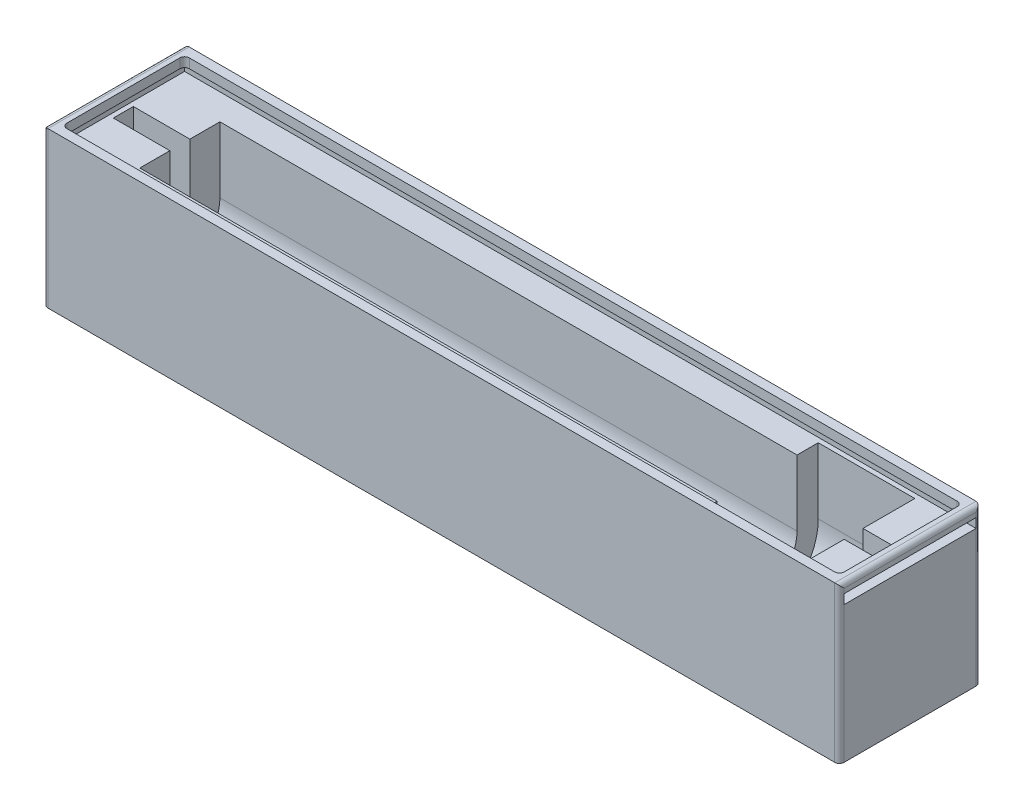
from build123d import *

# Parameters (mm, degrees)
BOSS_EXTRUDE1_DEPTH = 165
SKETCH3_W           = 30
SKETCH3_H           = 32
BOSS_EXTRUDE2_DEPTH = 2
SKETCH4_W           = 30
SKETCH4_H           = 32
BOSS_EXTRUDE3_DEPTH = 2
BOSS_EXTRUDE4_START = 10
BOSS_EXTRUDE4_DEPTH = 10
CUT_EXTRUDE1_DEPTH  = 10
BOSS_EXTRUDE6_DEPTH = 15
CUT_EXTRUDE2_DEPTH  = 15
BOSS_EXTRUDE7_DEPTH = 121
CUT_EXTRUDE3_DEPTH  = 121
SKETCH13_W          = 169
SKETCH13_H          = 30
CUT_EXTRUDE5_DEPTH  = 3
SKETCH14_W          = 169
SKETCH14_H          = 30
BOSS_EXTRUDE8_DEPTH = 3
SKETCH12_W          = 28
SKETCH12_H          = 2
CUT_EXTRUDE6_DEPTH  = 168
SKETCH16_W          = 165
SKETCH16_H          = 26
CUT_EXTRUDE7_DEPTH  = 3
CUT_EXTRUDE8_DEPTH  = 1.5
CUT_EXTRUDE9_DEPTH  = 3
SKETCH20_W          = 169
SKETCH20_H          = 30
BOSS_EXTRUDE9_DEPTH = 1
SKETCH21_W          = 165
SKETCH21_H          = 26
CUT_EXTRUDE10_DEPTH = 1
FILLET1_START       = -16
FILLET1_DEPTH       = 35
FILLET1_2_DEPTH     = 32
FILLET2_R           = 1


with BuildPart() as part:
    # Sketch2 → Boss-Extrude1 (new body)
    with BuildSketch(Plane(origin=(0, 0, 0), x_dir=(0, 0, -1), z_dir=(1, 0, 0))):
        with BuildLine():
            Line((-13, 0), (-13, 17))
            Line((-13, 17), (-15, 17))
            Line((-15, 17), (-15, -15))
            Line((-15, -15), (15, -15))
            Line((15, -15), (15, 17))
            Line((15, 17), (13, 17))
            Line((13, 17), (13, 0))
            ThreePointArc((13, 0), (0, -13), (-13, 0))
        make_face()
    extrude(amount=BOSS_EXTRUDE1_DEPTH)

    # Sketch3 → Boss-Extrude2 (add)
    with BuildSketch(Plane(origin=(165, 0, 0), x_dir=(0, 0, -1), z_dir=(1, 0, 0))):
        with Locations((0, 1)):
            Rectangle(SKETCH3_W, SKETCH3_H)
    extrude(amount=BOSS_EXTRUDE2_DEPTH)

    # Sketch4 → Boss-Extrude3 (add)
    with BuildSketch(Plane.ZY):
        with Locations((0, 1)):
            Rectangle(SKETCH4_W, SKETCH4_H)
    extrude(amount=BOSS_EXTRUDE3_DEPTH)

    # Sketch5 → Boss-Extrude4 (add)
    with BuildSketch(Plane.ZY.offset(-165).offset(BOSS_EXTRUDE4_START)):
        with BuildLine():
            Line((-13, 17), (-13, 0))
            ThreePointArc((-13, 0), (0, -13), (13, 0))
            Line((13, 0), (13, 17))
            Line((13, 17), (-13, 17))
        make_face()
    extrude(amount=-BOSS_EXTRUDE4_DEPTH)

    # Sketch6 → Cut-Extrude1 (cut)
    with BuildSketch(Plane.ZY.offset(-155)):
        with BuildLine():
            Line((-2, 0), (-2, 17))
            Line((-2, 17), (2, 17))
            Line((2, 17), (2, 0))
            ThreePointArc((2, 0), (0, -2), (-2, 0))
        make_face()
    extrude(amount=-CUT_EXTRUDE1_DEPTH, mode=Mode.SUBTRACT)

    # Sketch8 → Boss-Extrude6 (add)
    with BuildSketch(Plane(origin=(0, 0, 0), x_dir=(0, 0, -1), z_dir=(1, 0, 0))):
        with BuildLine():
            Line((13, 0), (13, 17))
            Line((13, 17), (-13, 17))
            Line((-13, 17), (-13, 0))
            ThreePointArc((-13, 0), (0, -13), (13, 0))
        make_face()
    extrude(amount=BOSS_EXTRUDE6_DEPTH)

    # Sketch9 → Cut-Extrude2 (cut)
    with BuildSketch(Plane(origin=(15, 0, 0), x_dir=(0, 0, -1), z_dir=(1, 0, 0))):
        with BuildLine():
            Line((-2.125, 0), (-2.125, 17))
            Line((-2.125, 17), (2.125, 17))
            Line((2.125, 17), (2.125, 0))
            ThreePointArc((2.125, 0), (0, -2.125), (-2.125, 0))
        make_face()
    extrude(amount=-CUT_EXTRUDE2_DEPTH, mode=Mode.SUBTRACT)

    # Sketch10 → Boss-Extrude7 (add)
    with BuildSketch(Plane(origin=(15, 0, 0), x_dir=(0, 0, -1), z_dir=(1, 0, 0))):
        with BuildLine():
            Line((13, 0), (13, 17))
            Line((13, 17), (-13, 17))
            Line((-13, 17), (-13, 0))
            ThreePointArc((-13, 0), (0, -13), (13, 0))
        make_face()
    extrude(amount=BOSS_EXTRUDE7_DEPTH)

    # Sketch11 → Cut-Extrude3 (cut)
    with BuildSketch(Plane(origin=(136, 0, 0), x_dir=(0, 0, -1), z_dir=(1, 0, 0))):
        with BuildLine():
            Line((-8.5, 0), (-8.5, 17))
            Line((-8.5, 17), (8.5, 17))
            Line((8.5, 17), (8.5, 0))
            ThreePointArc((8.5, 0), (0, -8.5), (-8.5, 0))
        make_face()
    extrude(amount=-CUT_EXTRUDE3_DEPTH, mode=Mode.SUBTRACT)

    # Sketch13 → Cut-Extrude5 (cut)
    with BuildSketch(Plane(origin=(0, 17, 0), x_dir=(1, 0, 0), z_dir=(0, 1, 0))):
        with Locations((82.5, 0)):
            Rectangle(SKETCH13_W, SKETCH13_H)
    extrude(amount=-CUT_EXTRUDE5_DEPTH, mode=Mode.SUBTRACT)

    # Sketch14 → Boss-Extrude8 (add)
    with BuildSketch(Plane(origin=(0, 14, 0), x_dir=(1, 0, 0), z_dir=(0, 1, 0))):
        with Locations((82.5, 0)):
            Rectangle(SKETCH14_W, SKETCH14_H)
    extrude(amount=BOSS_EXTRUDE8_DEPTH)

    # Sketch12 → Cut-Extrude6 (cut)
    with BuildSketch(Plane(origin=(167, 0, 0), x_dir=(0, 0, -1), z_dir=(1, 0, 0))):
        with Locations((0, 15)):
            Rectangle(SKETCH12_W, SKETCH12_H)
    extrude(amount=-CUT_EXTRUDE6_DEPTH, mode=Mode.SUBTRACT)

    # Sketch16 → Cut-Extrude7 (cut)
    with BuildSketch(Plane(origin=(0, 17, 0), x_dir=(1, 0, 0), z_dir=(0, 1, 0))):
        with Locations((82.5, 0)):
            Rectangle(SKETCH16_W, SKETCH16_H)
    extrude(amount=-CUT_EXTRUDE7_DEPTH, mode=Mode.SUBTRACT)

    # Sketch17 → Cut-Extrude8 (cut)
    with BuildSketch(Plane(origin=(136, 0, 0), x_dir=(0, 0, -1), z_dir=(1, 0, 0))):
        with BuildLine():
            Line((13, 14), (13, 0))
            ThreePointArc((13, 0), (0, -13), (-13, 0))
            Line((-13, 0), (-13, 14))
            Line((-13, 14), (-8.5, 14))
            Line((-8.5, 14), (-8.5, 0))
            ThreePointArc((-8.5, 0), (0, -8.5), (8.5, 0))
            Line((8.5, 0), (8.5, 14))
            Line((8.5, 14), (13, 14))
        make_face()
    extrude(amount=-CUT_EXTRUDE8_DEPTH, mode=Mode.SUBTRACT)

    # Sketch18 → Cut-Extrude9 (cut)
    with BuildSketch(Plane(origin=(15, 0, 0), x_dir=(0, 0, -1), z_dir=(1, 0, 0))):
        with BuildLine():
            Line((8.5, 0), (8.5, 14))
            Line((8.5, 14), (2.125, 14))
            Line((2.125, 14), (2.125, 0))
            ThreePointArc((2.125, 0), (0, -2.125), (-2.125, 0))
            Line((-2.125, 0), (-2.125, 14))
            Line((-2.125, 14), (-8.5, 14))
            Line((-8.5, 14), (-8.5, 0))
            ThreePointArc((-8.5, 0), (0, -8.5), (8.5, 0))
        make_face()
    extrude(amount=-CUT_EXTRUDE9_DEPTH, mode=Mode.SUBTRACT)

    # Sketch20 → Boss-Extrude9 (add)
    with BuildSketch(Plane(origin=(0, 17, 0), x_dir=(1, 0, 0), z_dir=(0, 1, 0))):
        with Locations((82.5, 0)):
            Rectangle(SKETCH20_W, SKETCH20_H)
    extrude(amount=BOSS_EXTRUDE9_DEPTH)

    # Sketch21 → Cut-Extrude10 (cut)
    with BuildSketch(Plane(origin=(0, 18, 0), x_dir=(1, 0, 0), z_dir=(0, 1, 0))):
        with Locations((82.5, 0)):
            Rectangle(SKETCH21_W, SKETCH21_H)
    extrude(amount=-CUT_EXTRUDE10_DEPTH, mode=Mode.SUBTRACT)

    # Fillet1: read off the stored shape, not the designer's step
    # Fillet1 outline → Fillet1 (cut)
    with BuildSketch(Plane(origin=(0, 0, 0), x_dir=(1, 0, 0), z_dir=(0, 1, 0)).offset(FILLET1_START)):
        with BuildLine():
            Line((-2, 15), (-2, 14))
            ThreePointArc((-2, 14), (-1.707106781, 14.707106781), (-1, 15))
            Line((-1, 15), (-2, 15))
        make_face()
        with BuildLine():
            ThreePointArc((-1, -15), (-1.707106781, -14.707106781), (-2, -14))
            Line((-2, -14), (-2, -15))
            Line((-2, -15), (-1, -15))
        make_face()
        with BuildLine():
            Line((167, 15), (166, 15))
            ThreePointArc((166, 15), (166.707106781, 14.707106781), (167, 14))
            Line((167, 14), (167, 15))
        make_face()
        with BuildLine():
            ThreePointArc((167, -14), (166.707106781, -14.707106781), (166, -15))
            Line((166, -15), (167, -15))
            Line((167, -15), (167, -14))
        make_face()
    extrude(amount=FILLET1_DEPTH, mode=Mode.SUBTRACT)

    # Fillet1 2 outline → Fillet1 2 (cut)
    with BuildSketch(Plane.XY.offset(FILLET1_START)):
        with BuildLine():
            Line((167, 18), (166, 18))
            ThreePointArc((166, 18), (166.707106781, 17.707106781), (167, 17))
            Line((167, 17), (167, 18))
        make_face()
        with BuildLine():
            ThreePointArc((-2, 17), (-1.707106781, 17.707106781), (-1, 18))
            Line((-1, 18), (-2, 18))
            Line((-2, 18), (-2, 17))
        make_face()
    extrude(amount=FILLET1_2_DEPTH, mode=Mode.SUBTRACT)

    # Fillet2
    fillet2_edges = [part.edges().sort_by_distance(p)[0] for p in [
        (0, 17, 13),
        (0, 17, -13),
        (165, 17, -13),
        (165, 17, 13),
    ]]
    fillet(fillet2_edges, radius=FILLET2_R)


solid = part.part
